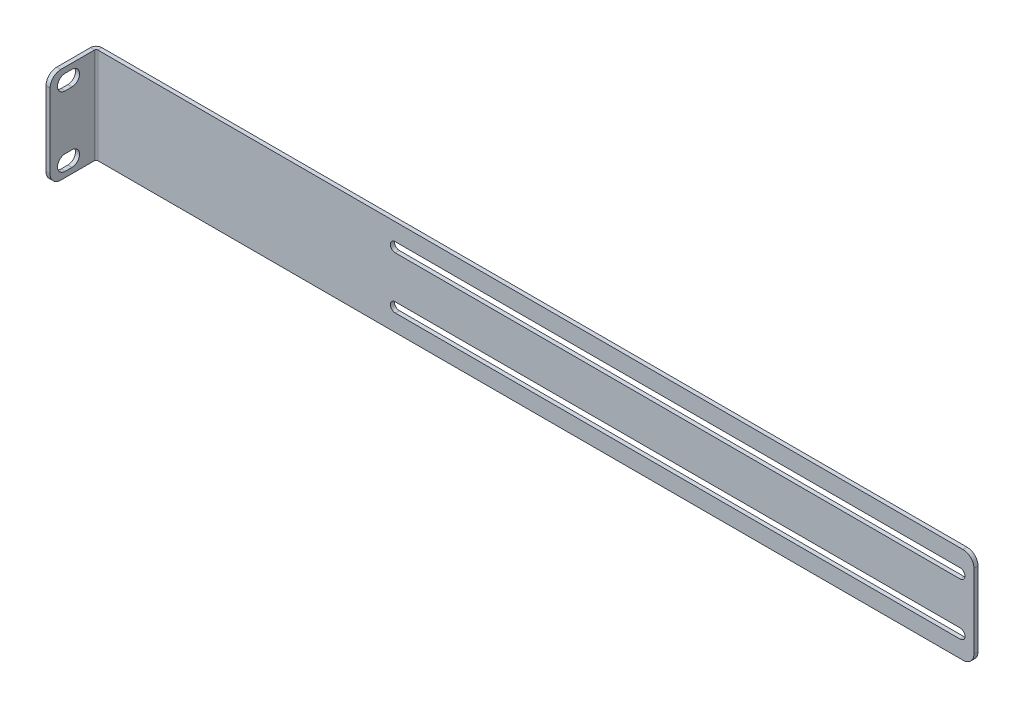
from build123d import *

# Parameters (mm, degrees)
SKETCH1_W                    = 406.4
SKETCH1_H                    = 44.196
BASE_FLANGE1_DEPTH           = 1.88
EDGE_FLANGE1_STRIP_W         = 8.9932
EDGE_FLANGE1_STRIP_H         = 1.88
EDGE_FLANGE1_STRIP_CUT_DEPTH = 44.196
EDGE_FLANGE1_DEPTH           = 44.196
CUT_EXTRUDE1_REACH           = 411.347
FILLET1_R                    = 5


# Sheet-metal steps are written as plain solids
with BuildPart() as part:
    # Sketch1 → Base-Flange1 (new body)
    with BuildSketch(Plane.XY):
        with Locations((203.2, 22.098)):
            Rectangle(SKETCH1_W, SKETCH1_H)
        with BuildLine():
            Line((139.7, 36.2225), (400.05, 36.2225))
            ThreePointArc((400.05, 36.2225), (402.2725, 34), (400.05, 31.7775))
            Line((400.05, 31.7775), (139.7, 31.7775))
            ThreePointArc((139.7, 31.7775), (137.4775, 34), (139.7, 36.2225))
        make_face(mode=Mode.SUBTRACT)
        with BuildLine():
            Line((139.7, 12.2225), (400.05, 12.2225))
            ThreePointArc((400.05, 12.2225), (402.2725, 10), (400.05, 7.7775))
            Line((400.05, 7.7775), (139.7, 7.7775))
            ThreePointArc((139.7, 7.7775), (137.4775, 10), (139.7, 12.2225))
        make_face(mode=Mode.SUBTRACT)
    extrude(amount=-BASE_FLANGE1_DEPTH)

    # Edge-Flange1 strip (across the edge) → Edge-Flange1 strip cut (cut)
    with BuildSketch(Plane.XZ.offset(-44.196)):
        with Locations((-1.88, -0.94)):
            Rectangle(EDGE_FLANGE1_STRIP_W, EDGE_FLANGE1_STRIP_H)
    extrude(amount=EDGE_FLANGE1_STRIP_CUT_DEPTH, mode=Mode.SUBTRACT)

    # Edge-Flange1 section (across the edge) → Edge-Flange1 (add)
    with BuildSketch(Plane.XZ.offset(-44.196)):
        with BuildLine():
            Line((0, 0.7366), (0, 21.234))
            Line((0, 21.234), (1.88, 21.234))
            Line((1.88, 21.234), (1.88, 0.7366))
            ThreePointArc((1.88, 0.7366), (2.095745145, 0.215745145), (2.6166, 0))
            Line((2.6166, 0), (2.6166, -1.88))
            ThreePointArc((2.6166, -1.88), (0.766384396, -1.113615604), (0, 0.7366))
        make_face()
    extrude(amount=EDGE_FLANGE1_DEPTH)

    # Sketch9 → Cut-Extrude1 (cut, up to next)
    with BuildSketch(Plane.ZY, mode=Mode.PRIVATE) as cut_extrude1_sk1:
        with BuildLine():
            Line((11.145, 41.656), (14.305, 41.656))
            ThreePointArc((14.305, 41.656), (17.805, 38.156), (14.305, 34.656))
            Line((14.305, 34.656), (11.145, 34.656))
            ThreePointArc((11.145, 34.656), (7.645, 38.156), (11.145, 41.656))
        make_face()
    cut_extrude1_tool1 = extrude(cut_extrude1_sk1.sketch, amount=-CUT_EXTRUDE1_REACH, mode=Mode.PRIVATE) & part.part
    # Sketch9 → Cut-Extrude1 (cut, up to next)
    with BuildSketch(Plane.ZY, mode=Mode.PRIVATE) as cut_extrude1_sk2:
        with BuildLine():
            Line((11.145, 9.54), (14.305, 9.54))
            ThreePointArc((14.305, 9.54), (17.805, 6.04), (14.305, 2.54))
            Line((14.305, 2.54), (11.145, 2.54))
            ThreePointArc((11.145, 2.54), (7.645, 6.04), (11.145, 9.54))
        make_face()
    cut_extrude1_tool2 = extrude(cut_extrude1_sk2.sketch, amount=-CUT_EXTRUDE1_REACH, mode=Mode.PRIVATE) & part.part
    add(cut_extrude1_tool1.solids().sort_by_distance((0, 38.156, 12.725))[0], mode=Mode.SUBTRACT)
    add(cut_extrude1_tool2.solids().sort_by_distance((0, 6.04, 12.725))[0], mode=Mode.SUBTRACT)

    # Fillet1
    fillet1_edges = [part.edges().sort_by_distance(p)[0] for p in [
        (0.94, 44.196, 21.234),
        (0.94, 0, 21.234),
        (406.4, 44.196, -0.94),
        (406.4, 0, -0.94),
    ]]
    fillet(fillet1_edges, radius=FILLET1_R)


solid = part.part
